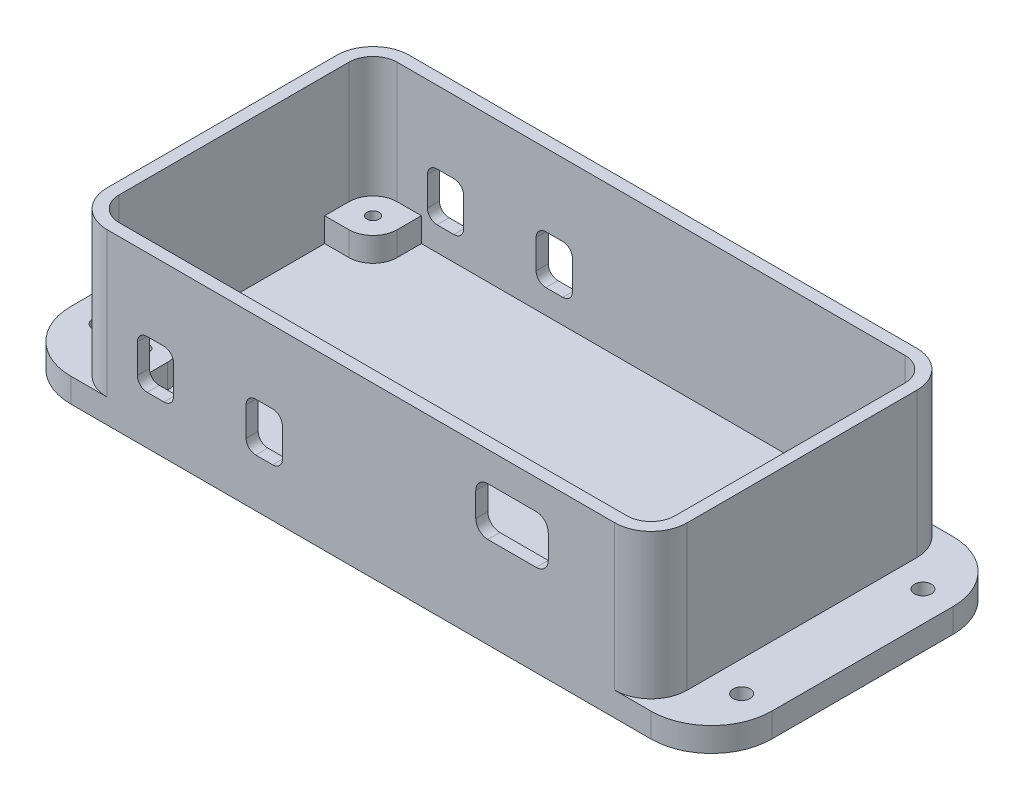
from build123d import *

# Parameters (mm, degrees)
SKETCH1_W           = 147.32
SKETCH1_H           = 63.5
BOSS_EXTRUDE3_DEPTH = 5.08
FILLET4_R           = 12.7
SKETCH4_W           = 121.92
SKETCH4_H           = 63.5
SKETCH4_W_2         = 116.84
SKETCH4_H_2         = 58.42
BOSS_EXTRUDE4_DEPTH = 30.48
CUT_EXTRUDE4_REACH  = 165.293
SKETCH7_R           = 1.778
SKETCH9_W           = 10.16
SKETCH9_H           = 10.16
BOSS_EXTRUDE5_DEPTH = 5.08
FILLET9_R           = 5.08
SKETCH10_R          = 3.175
CUT_EXTRUDE7_DEPTH  = 163.421034352
FILLET11_R          = 5.08
FILLET12_R          = 7.62
CUT_EXTRUDE8_REACH  = 166.317
SKETCH12_W          = 15.24
SKETCH12_H          = 10.16
FILLET13_R          = 2.54
SKETCH13_W          = 7.62
SKETCH13_H          = 10.16
CUT_EXTRUDE9_DEPTH  = 165.316602935
FILLET14_R          = 2.032
SKETCH11_R          = 3.175
SKETCH11_R_2        = 1.27
BOSS_EXTRUDE7_DEPTH = 5.08


with BuildPart() as part:
    # Sketch1 → Boss-Extrude3 (new body)
    with BuildSketch(Plane(origin=(0, 0, 0), x_dir=(1, 0, 0), z_dir=(0, 1, 0))):
        with Locations((73.66, 31.75)):
            Rectangle(SKETCH1_W, SKETCH1_H)
    extrude(amount=BOSS_EXTRUDE3_DEPTH)

    # Fillet4
    fillet4_edges = [part.edges().sort_by_distance(p)[0] for p in [
        (147.32, 2.54, -63.5),
        (147.32, 2.54, 0),
        (0, 2.54, 0),
        (0, 2.54, -63.5),
    ]]
    fillet(fillet4_edges, radius=FILLET4_R)

    # Sketch4 → Boss-Extrude4 (add)
    with BuildSketch(Plane(origin=(0, 5.08, 0), x_dir=(1, 0, 0), z_dir=(0, 1, 0))):
        with Locations((73.66, 31.75)):
            Rectangle(SKETCH4_W, SKETCH4_H)
        with Locations((73.66, 31.75)):
            Rectangle(SKETCH4_W_2, SKETCH4_H_2, mode=Mode.SUBTRACT)
    extrude(amount=BOSS_EXTRUDE4_DEPTH)

    # Sketch7 → Cut-Extrude4 (cut, up to next)
    with BuildSketch(Plane(origin=(0, 5.08, 0), x_dir=(1, 0, 0), z_dir=(0, 1, 0)), mode=Mode.PRIVATE) as cut_extrude4_sk1:
        with Locations((6.35, 50.8)):
            Circle(SKETCH7_R)
    cut_extrude4_tool1 = extrude(cut_extrude4_sk1.sketch, amount=-CUT_EXTRUDE4_REACH, mode=Mode.PRIVATE) & part.part
    # Sketch7 → Cut-Extrude4 (cut, up to next)
    with BuildSketch(Plane(origin=(0, 5.08, 0), x_dir=(1, 0, 0), z_dir=(0, 1, 0)), mode=Mode.PRIVATE) as cut_extrude4_sk2:
        with Locations((6.35, 12.7)):
            Circle(SKETCH7_R)
    cut_extrude4_tool2 = extrude(cut_extrude4_sk2.sketch, amount=-CUT_EXTRUDE4_REACH, mode=Mode.PRIVATE) & part.part
    # Sketch7 → Cut-Extrude4 (cut, up to next)
    with BuildSketch(Plane(origin=(0, 5.08, 0), x_dir=(1, 0, 0), z_dir=(0, 1, 0)), mode=Mode.PRIVATE) as cut_extrude4_sk3:
        with Locations((140.97, 12.7)):
            Circle(SKETCH7_R)
    cut_extrude4_tool3 = extrude(cut_extrude4_sk3.sketch, amount=-CUT_EXTRUDE4_REACH, mode=Mode.PRIVATE) & part.part
    # Sketch7 → Cut-Extrude4 (cut, up to next)
    with BuildSketch(Plane(origin=(0, 5.08, 0), x_dir=(1, 0, 0), z_dir=(0, 1, 0)), mode=Mode.PRIVATE) as cut_extrude4_sk4:
        with Locations((140.97, 50.8)):
            Circle(SKETCH7_R)
    cut_extrude4_tool4 = extrude(cut_extrude4_sk4.sketch, amount=-CUT_EXTRUDE4_REACH, mode=Mode.PRIVATE) & part.part
    add(cut_extrude4_tool1.solids().sort_by_distance((6.35, 5.08, -50.8))[0], mode=Mode.SUBTRACT)
    add(cut_extrude4_tool2.solids().sort_by_distance((6.35, 5.08, -12.7))[0], mode=Mode.SUBTRACT)
    add(cut_extrude4_tool3.solids().sort_by_distance((140.97, 5.08, -12.7))[0], mode=Mode.SUBTRACT)
    add(cut_extrude4_tool4.solids().sort_by_distance((140.97, 5.08, -50.8))[0], mode=Mode.SUBTRACT)

    # Sketch9 → Boss-Extrude5 (add)
    with BuildSketch(Plane(origin=(0, 5.08, 0), x_dir=(1, 0, 0), z_dir=(0, 1, 0))):
        with Locations((20.32, 55.88)):
            Rectangle(SKETCH9_W, SKETCH9_H)
        with Locations((127, 55.88)):
            Rectangle(SKETCH9_W, SKETCH9_H)
        with Locations((127, 7.62)):
            Rectangle(SKETCH9_W, SKETCH9_H)
        with Locations((20.32, 7.62)):
            Rectangle(SKETCH9_W, SKETCH9_H)
    extrude(amount=BOSS_EXTRUDE5_DEPTH)

    # Fillet9
    fillet9_edges = [part.edges().sort_by_distance(p)[0] for p in [
        (121.92, 7.62, -12.7),
        (25.4, 7.62, -12.7),
        (121.92, 7.62, -50.8),
        (25.4, 7.62, -50.8),
    ]]
    fillet(fillet9_edges, radius=FILLET9_R)

    # Sketch10 → Cut-Extrude7 (cut, through all)
    with BuildSketch(Plane(origin=(0, 10.16, 0), x_dir=(1, 0, 0), z_dir=(0, 1, 0))):
        with Locations((20.32, 55.88)):
            Circle(SKETCH10_R)
        with Locations((127, 55.88)):
            Circle(SKETCH10_R)
        with Locations((20.32, 7.62)):
            Circle(SKETCH10_R)
        with Locations((127, 7.62)):
            Circle(SKETCH10_R)
    extrude(amount=-CUT_EXTRUDE7_DEPTH, mode=Mode.SUBTRACT)

    # Fillet11
    fillet11_edges = [part.edges().sort_by_distance(p)[0] for p in [
        (132.08, 22.86, -2.54),
        (15.24, 22.86, -2.54),
        (132.08, 22.86, -60.96),
        (15.24, 22.86, -60.96),
    ]]
    fillet(fillet11_edges, radius=FILLET11_R)

    # Fillet12
    fillet12_edges = [part.edges().sort_by_distance(p)[0] for p in [
        (134.62, 20.32, 0),
        (134.62, 20.32, -63.5),
        (12.7, 20.32, -63.5),
        (12.7, 20.32, 0),
    ]]
    fillet(fillet12_edges, radius=FILLET12_R)

    # Sketch12 → Cut-Extrude8 (cut, up to next)
    with BuildSketch(Plane.XY, mode=Mode.PRIVATE) as cut_extrude8_sk1:
        with Locations((105.41, 24.257)):
            Rectangle(SKETCH12_W, SKETCH12_H)
    cut_extrude8_tool1 = extrude(cut_extrude8_sk1.sketch, amount=-CUT_EXTRUDE8_REACH, mode=Mode.PRIVATE) & part.part
    add(cut_extrude8_tool1.solids().sort_by_distance((105.41, 24.257, 0))[0], mode=Mode.SUBTRACT)

    # Fillet13
    fillet13_edges = [part.edges().sort_by_distance(p)[0] for p in [
        (97.79, 19.177, -1.27),
        (97.79, 29.337, -1.27),
        (113.03, 29.337, -1.27),
        (113.03, 19.177, -1.27),
    ]]
    fillet(fillet13_edges, radius=FILLET13_R)

    # Sketch13 → Cut-Extrude9 (cut, through all)
    with BuildSketch(Plane.XY):
        with Locations((30.48, 15.24)):
            Rectangle(SKETCH13_W, SKETCH13_H)
        with Locations((53.34, 15.24)):
            Rectangle(SKETCH13_W, SKETCH13_H)
    extrude(amount=-CUT_EXTRUDE9_DEPTH, mode=Mode.SUBTRACT)

    # Fillet14
    fillet14_edges = [part.edges().sort_by_distance(p)[0] for p in [
        (34.29, 10.16, -62.23),
        (57.15, 10.16, -62.23),
        (34.29, 20.32, -62.23),
        (57.15, 20.32, -62.23),
        (26.67, 20.32, -62.23),
        (49.53, 20.32, -62.23),
        (49.53, 10.16, -62.23),
        (26.67, 10.16, -62.23),
        (49.53, 10.16, -1.27),
        (26.67, 10.16, -1.27),
        (49.53, 20.32, -1.27),
        (26.67, 20.32, -1.27),
        (57.15, 20.32, -1.27),
        (34.29, 20.32, -1.27),
        (57.15, 10.16, -1.27),
        (34.29, 10.16, -1.27),
    ]]
    fillet(fillet14_edges, radius=FILLET14_R)

    # Sketch11 → Boss-Extrude7 (add)
    # profile 1 of 4: a face of its own
    with BuildSketch(Plane(origin=(0, 10.16, 0), x_dir=(1, 0, 0), z_dir=(0, 1, 0))):
        with Locations((20.32, 55.88)):
            Circle(SKETCH11_R)
        with Locations((20.32, 55.88)):
            Circle(SKETCH11_R_2, mode=Mode.SUBTRACT)
    # profile 2 of 4: a face of its own
    with BuildSketch(Plane(origin=(0, 10.16, 0), x_dir=(1, 0, 0), z_dir=(0, 1, 0))):
        with Locations((127, 55.88)):
            Circle(SKETCH11_R)
        with Locations((127, 55.88)):
            Circle(SKETCH11_R_2, mode=Mode.SUBTRACT)
    # profile 3 of 4: a face of its own
    with BuildSketch(Plane(origin=(0, 10.16, 0), x_dir=(1, 0, 0), z_dir=(0, 1, 0))):
        with Locations((20.32, 7.62)):
            Circle(SKETCH11_R)
        with Locations((20.32, 7.62)):
            Circle(SKETCH11_R_2, mode=Mode.SUBTRACT)
    # profile 4 of 4: a face of its own
    with BuildSketch(Plane(origin=(0, 10.16, 0), x_dir=(1, 0, 0), z_dir=(0, 1, 0))):
        with Locations((127, 7.62)):
            Circle(SKETCH11_R)
        with Locations((127, 7.62)):
            Circle(SKETCH11_R_2, mode=Mode.SUBTRACT)
    extrude(amount=-BOSS_EXTRUDE7_DEPTH)


solid = part.part
